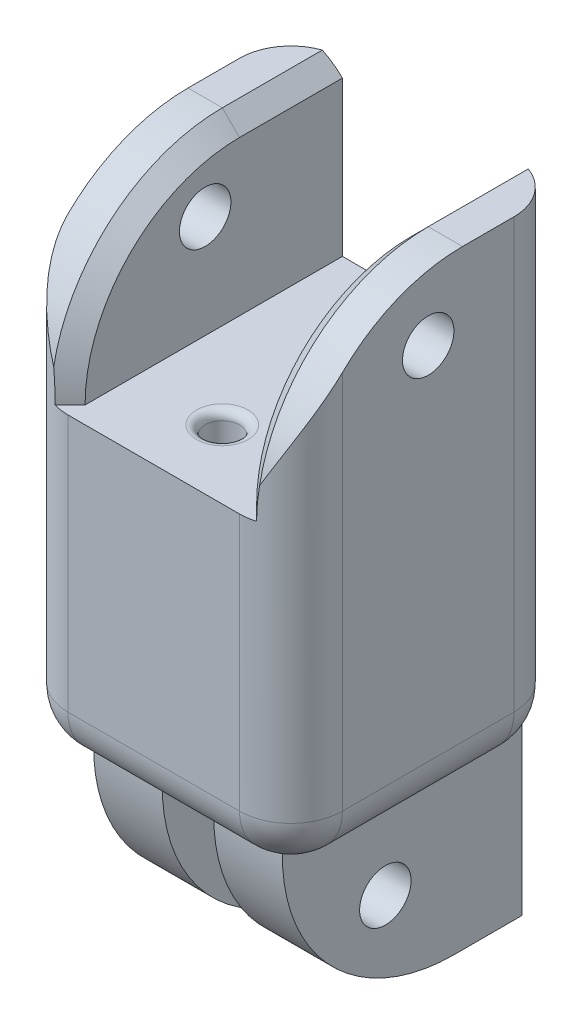
from build123d import *

# Parameters (mm, degrees)
BOSS_EXTRUDE1_DEPTH     = 16
CUT_EXTRUDE1_DEPTH      = 44.384905209
CUT_EXTRUDE1_DEPTH_BACK = 44.384905209
SKETCH2_R               = 1.5
FILLET1_DEPTH           = 38
SKETCH3_R               = 1
CUT_EXTRUDE2_DEPTH      = 35.960692377
FILLET2_R               = 3
CHAMFER1_SIZE           = 1
CONG_1_R                = 0.5


with BuildPart() as part:
    # Sketch1 → Boss-Extrude1 (new body)
    with BuildSketch(Plane.XY):
        Polygon((0, 0), (0, 10), (-2.5, 10), (-2.5, 38), (0.5, 38), (0.5, 28), (10.5, 28), (10.5, 38), (13.5, 38), (13.5, 10), (11, 10), (11, 0), (7, 0), (7, 10), (4, 10), (4, 0), align=None)
    extrude(amount=BOSS_EXTRUDE1_DEPTH)

    # Sketch2 → Cut-Extrude1 (cut, two sides: drawn at the far end of the back side and taken through both)
    with BuildSketch(Plane(origin=(11, 0, 0), x_dir=(0, 0, -1), z_dir=(1, 0, 0)).offset(-CUT_EXTRUDE1_DEPTH_BACK)):
        with BuildLine():
            Line((-16, 0), (-4, 0))
            ThreePointArc((-4, 0), (-11.071067812, 2.928932188), (-14, 10))
            Line((-14, 10), (-16, 10))
            Line((-16, 10), (-16, 0))
        make_face()
        with BuildLine():
            Line((-16, 38), (-16, 28))
            ThreePointArc((-16, 28), (-13.071067812, 35.071067812), (-6, 38))
            Line((-6, 38), (-16, 38))
        make_face()
        with Locations((-8, 5)):
            Circle(SKETCH2_R)
        with Locations(Location((-8, 34, 0), (0, 0, 90))):
            Circle(SKETCH2_R)
    extrude(amount=CUT_EXTRUDE1_DEPTH + CUT_EXTRUDE1_DEPTH_BACK, mode=Mode.SUBTRACT)

    # Fillet1: read off the stored shape, not the designer's step
    # Fillet1 outline → Fillet1 (cut)
    with BuildSketch(Plane(origin=(0, 0, 0), x_dir=(1, 0, 0), z_dir=(0, 1, 0))):
        with BuildLine():
            Line((13.5, 0), (10.5, 0))
            ThreePointArc((10.5, 0), (12.621320344, -0.878679656), (13.5, -3))
            Line((13.5, -3), (13.5, 0))
        make_face()
        with BuildLine():
            ThreePointArc((-2.5, -3), (-1.621320344, -0.878679656), (0.5, 0))
            Line((0.5, 0), (-2.5, 0))
            Line((-2.5, 0), (-2.5, -3))
        make_face()
        with BuildLine():
            Line((13.5, -16), (13.5, -13))
            ThreePointArc((13.5, -13), (12.621320344, -15.121320344), (10.5, -16))
            Line((10.5, -16), (13.5, -16))
        make_face()
        with BuildLine():
            ThreePointArc((0.5, -16), (-1.621320344, -15.121320344), (-2.5, -13))
            Line((-2.5, -13), (-2.5, -16))
            Line((-2.5, -16), (0.5, -16))
        make_face()
    extrude(amount=FILLET1_DEPTH, mode=Mode.SUBTRACT)

    # Sketch3 → Cut-Extrude2 (cut, through all)
    with BuildSketch(Plane.XZ.offset(-10)):
        with Locations(Location((5.5, 12, 0), (0, 0, 270))):
            Circle(SKETCH3_R)
        with Locations(Location((5.5, 4, 0), (0, 0, 270))):
            Circle(SKETCH3_R)
    extrude(amount=-CUT_EXTRUDE2_DEPTH, mode=Mode.SUBTRACT)

    # Fillet2
    # the kernel refuses this fillet: 3 mm, written as the material it takes off along each edge
    with BuildSketch(Plane(origin=(0.499999998, 10, 2.999999998), x_dir=(-1.0, 0, 5.011576341616869e-10), z_dir=(5.011576341616869e-10, 0, 1.0))) as fillet2_piece_1_section:
        with BuildLine():
            CenterArc((2.999999998 - FILLET2_R, -FILLET2_R), FILLET2_R, 0, 89.999999971)
            Line((2.999999998 - FILLET2_R, 0), (2.999999998, 0))
            Line((2.999999998, 0), (2.999999998, -FILLET2_R))
        make_face()
    fillet2_piece_1 = revolve(axis=Axis((0.499999998, 10, 2.999999998), (0, -1, 0)), revolution_arc=223.691304691, mode=Mode.PRIVATE)
    fillet2_piece_1 = split(fillet2_piece_1, bisect_by=Plane(origin=(0, 10, 2.999999998), z_dir=(-1, 0, 0)), keep=Keep.TOP, mode=Mode.PRIVATE)
    add(fillet2_piece_1, mode=Mode.SUBTRACT)
    with BuildSketch(Plane(origin=(10.500000002, 10, 2.999999998), x_dir=(-0.7230719874734535, 0, 0.6907726839787384), z_dir=(0.6907726839787384, 0, 0.7230719874734535))) as fillet2_piece_2_section:
        with BuildLine():
            CenterArc((2.999999998 - FILLET2_R, -FILLET2_R), FILLET2_R, 0, 89.999999971)
            Line((2.999999998, -FILLET2_R), (2.999999998, 0))
            Line((2.999999998, 0), (2.999999998 - FILLET2_R, 0))
        make_face()
    fillet2_piece_2 = revolve(axis=Axis((10.500000002, 10, 2.999999998), (0, -1, 0)), revolution_arc=223.691304691, mode=Mode.PRIVATE)
    fillet2_piece_2 = split(fillet2_piece_2, bisect_by=Plane(origin=(11, 10, 2.999999998), z_dir=(1, 0, 0)), keep=Keep.TOP, mode=Mode.PRIVATE)
    add(fillet2_piece_2, mode=Mode.SUBTRACT)
    with BuildSketch(Plane(origin=(10.5, 10, 16), x_dir=(0, 0, -1), z_dir=(-1, 0, 0))) as fillet2_piece_3_section:
        with BuildLine():
            CenterArc((FILLET2_R, -FILLET2_R), FILLET2_R, 90, 90)
            Line((0, -FILLET2_R), (0, 0))
            Line((0, 0), (FILLET2_R, 0))
        make_face()
    fillet2_piece_3 = extrude(amount=10, mode=Mode.PRIVATE)
    fillet2_piece_3 = fillet2_piece_3 - Plane(origin=(10.5, 10, 4), x_dir=(0, -1, 0), z_dir=(-1, 0, 0)) * Cylinder(10, 32, mode=Mode.PRIVATE)
    fillet2_piece_3 = split(fillet2_piece_3, bisect_by=Plane(origin=(7, 10, 16), z_dir=(1, 0, 0)), keep=Keep.TOP, mode=Mode.PRIVATE)
    add(fillet2_piece_3, mode=Mode.SUBTRACT)
    with BuildSketch(Plane(origin=(10.5, 10, 16), x_dir=(0, 0, -1), z_dir=(-1, 0, 0))) as fillet2_piece_4_section:
        with BuildLine():
            CenterArc((FILLET2_R, -FILLET2_R), FILLET2_R, 90, 90)
            Line((0, -FILLET2_R), (0, 0))
            Line((0, 0), (FILLET2_R, 0))
        make_face()
    fillet2_piece_4 = extrude(amount=10, mode=Mode.PRIVATE)
    fillet2_piece_4 = fillet2_piece_4 & Plane(origin=(10.5, 10, 4), x_dir=(0, -1, 0), z_dir=(-1, 0, 0)) * Cylinder(10, 32, mode=Mode.PRIVATE)
    fillet2_piece_4 = split(fillet2_piece_4, bisect_by=Plane(origin=(4, 10, 16), z_dir=(1, 0, 0)), keep=Keep.TOP, mode=Mode.PRIVATE)
    fillet2_piece_4 = split(fillet2_piece_4, bisect_by=Plane(origin=(7, 10, 16), z_dir=(-1, 0, 0)), keep=Keep.TOP, mode=Mode.PRIVATE)
    add(fillet2_piece_4, mode=Mode.SUBTRACT)
    with BuildSketch(Plane(origin=(10.5, 10, 16), x_dir=(0, 0, -1), z_dir=(-1, 0, 0))) as fillet2_piece_5_section:
        with BuildLine():
            CenterArc((FILLET2_R, -FILLET2_R), FILLET2_R, 90, 90)
            Line((0, -FILLET2_R), (0, 0))
            Line((0, 0), (FILLET2_R, 0))
        make_face()
    fillet2_piece_5 = extrude(amount=10, mode=Mode.PRIVATE)
    fillet2_piece_5 = fillet2_piece_5 - Plane(origin=(10.5, 10, 4), x_dir=(0, -1, 0), z_dir=(-1, 0, 0)) * Cylinder(10, 32, mode=Mode.PRIVATE)
    fillet2_piece_5 = split(fillet2_piece_5, bisect_by=Plane(origin=(4, 10, 16), z_dir=(1, 0, 0)), keep=Keep.TOP, mode=Mode.PRIVATE)
    fillet2_piece_5 = split(fillet2_piece_5, bisect_by=Plane(origin=(7, 10, 16), z_dir=(-1, 0, 0)), keep=Keep.TOP, mode=Mode.PRIVATE)
    add(fillet2_piece_5, mode=Mode.SUBTRACT)
    with BuildSketch(Plane(origin=(10.5, 10, 16), x_dir=(0, 0, -1), z_dir=(-1, 0, 0))) as fillet2_piece_6_section:
        with BuildLine():
            CenterArc((FILLET2_R, -FILLET2_R), FILLET2_R, 90, 90)
            Line((0, -FILLET2_R), (0, 0))
            Line((0, 0), (FILLET2_R, 0))
        make_face()
    fillet2_piece_6 = extrude(amount=10, mode=Mode.PRIVATE)
    fillet2_piece_6 = fillet2_piece_6 - Plane(origin=(10.5, 10, 4), x_dir=(0, -1, 0), z_dir=(-1, 0, 0)) * Cylinder(10, 32, mode=Mode.PRIVATE)
    fillet2_piece_6 = split(fillet2_piece_6, bisect_by=Plane(origin=(4, 10, 16), z_dir=(-1, 0, 0)), keep=Keep.TOP, mode=Mode.PRIVATE)
    add(fillet2_piece_6, mode=Mode.SUBTRACT)
    with BuildSketch(Plane(origin=(10.500000002, 10, 13.000000002), x_dir=(1.0, 0, -5.011588183995811e-10), z_dir=(-5.011588183995811e-10, 0, -1.0))) as fillet2_piece_7_section:
        with BuildLine():
            CenterArc((2.999999998 - FILLET2_R, -FILLET2_R), FILLET2_R, 0, 89.999999971)
            Line((2.999999998, -FILLET2_R), (2.999999998, 0))
            Line((2.999999998, 0), (2.999999998 - FILLET2_R, 0))
        make_face()
    fillet2_piece_7 = revolve(axis=Axis((10.500000002, 10, 13.000000002), (0, -1, 0)), revolution_arc=90.000000057, mode=Mode.PRIVATE)
    fillet2_piece_7 = fillet2_piece_7 & Plane(origin=(10.500000002, 10, 4), x_dir=(0, -1, 0), z_dir=(-1, 0, 0)) * Cylinder(10, 12, mode=Mode.PRIVATE)
    fillet2_piece_7 = split(fillet2_piece_7, bisect_by=Plane(origin=(11, 10, 13.000000002), z_dir=(1, 0, 0)), keep=Keep.TOP, mode=Mode.PRIVATE)
    add(fillet2_piece_7, mode=Mode.SUBTRACT)
    with BuildSketch(Plane(origin=(10.500000002, 10, 13.000000002), x_dir=(1.0, 0, -5.011588183995811e-10), z_dir=(-5.011588183995811e-10, 0, -1.0))) as fillet2_piece_8_section:
        with BuildLine():
            CenterArc((2.999999998 - FILLET2_R, -FILLET2_R), FILLET2_R, 0, 89.999999971)
            Line((2.999999998, -FILLET2_R), (2.999999998, 0))
            Line((2.999999998, 0), (2.999999998 - FILLET2_R, 0))
        make_face()
    fillet2_piece_8 = revolve(axis=Axis((10.500000002, 10, 13.000000002), (0, -1, 0)), revolution_arc=90.000000057, mode=Mode.PRIVATE)
    fillet2_piece_8 = fillet2_piece_8 - Plane(origin=(10.500000002, 10, 4), x_dir=(0, -1, 0), z_dir=(-1, 0, 0)) * Cylinder(10, 12, mode=Mode.PRIVATE)
    fillet2_piece_8 = split(fillet2_piece_8, bisect_by=Plane(origin=(11, 10, 13.000000002), z_dir=(-1, 0, 0)), keep=Keep.TOP, mode=Mode.PRIVATE)
    add(fillet2_piece_8, mode=Mode.SUBTRACT)
    with BuildSketch(Plane(origin=(10.500000002, 10, 13.000000002), x_dir=(1.0, 0, -5.011588183995811e-10), z_dir=(-5.011588183995811e-10, 0, -1.0))) as fillet2_piece_9_section:
        with BuildLine():
            CenterArc((2.999999998 - FILLET2_R, -FILLET2_R), FILLET2_R, 0, 89.999999971)
            Line((2.999999998, -FILLET2_R), (2.999999998, 0))
            Line((2.999999998, 0), (2.999999998 - FILLET2_R, 0))
        make_face()
    fillet2_piece_9 = revolve(axis=Axis((10.500000002, 10, 13.000000002), (0, -1, 0)), revolution_arc=90.000000057, mode=Mode.PRIVATE)
    fillet2_piece_9 = fillet2_piece_9 - Plane(origin=(10.500000002, 10, 4), x_dir=(0, -1, 0), z_dir=(-1, 0, 0)) * Cylinder(10, 12, mode=Mode.PRIVATE)
    fillet2_piece_9 = split(fillet2_piece_9, bisect_by=Plane(origin=(11, 10, 13.000000002), z_dir=(1, 0, 0)), keep=Keep.TOP, mode=Mode.PRIVATE)
    add(fillet2_piece_9, mode=Mode.SUBTRACT)
    with BuildSketch(Plane(origin=(0.499999998, 10, 13.000000002), x_dir=(5.011584483252393e-10, 0, 1.0), z_dir=(1.0, 0, -5.011584483252393e-10))) as fillet2_piece_10_section:
        with BuildLine():
            CenterArc((2.999999998 - FILLET2_R, -FILLET2_R), FILLET2_R, 0, 89.999999971)
            Line((2.999999998, -FILLET2_R), (2.999999998, 0))
            Line((2.999999998, 0), (2.999999998 - FILLET2_R, 0))
        make_face()
    fillet2_piece_10 = revolve(axis=Axis((0.499999998, 10, 13.000000002), (0, -1, 0)), revolution_arc=90.000000057, mode=Mode.PRIVATE)
    fillet2_piece_10 = split(fillet2_piece_10, bisect_by=Plane(origin=(0, 10, 13.000000002), z_dir=(1, 0, 0)), keep=Keep.TOP, mode=Mode.PRIVATE)
    fillet2_piece_10 = fillet2_piece_10 - Plane(origin=(0.499999998, 10, 4), x_dir=(0, -1, 0), z_dir=(-1, 0, 0)) * Cylinder(10, 12, mode=Mode.PRIVATE)
    add(fillet2_piece_10, mode=Mode.SUBTRACT)
    with BuildSketch(Plane(origin=(0.499999998, 10, 13.000000002), x_dir=(5.011584483252393e-10, 0, 1.0), z_dir=(1.0, 0, -5.011584483252393e-10))) as fillet2_piece_11_section:
        with BuildLine():
            CenterArc((2.999999998 - FILLET2_R, -FILLET2_R), FILLET2_R, 0, 89.999999971)
            Line((2.999999998, -FILLET2_R), (2.999999998, 0))
            Line((2.999999998, 0), (2.999999998 - FILLET2_R, 0))
        make_face()
    fillet2_piece_11 = revolve(axis=Axis((0.499999998, 10, 13.000000002), (0, -1, 0)), revolution_arc=90.000000057, mode=Mode.PRIVATE)
    fillet2_piece_11 = split(fillet2_piece_11, bisect_by=Plane(origin=(0, 10, 13.000000002), z_dir=(-1, 0, 0)), keep=Keep.TOP, mode=Mode.PRIVATE)
    fillet2_piece_11 = fillet2_piece_11 & Plane(origin=(0.499999998, 10, 4), x_dir=(0, -1, 0), z_dir=(-1, 0, 0)) * Cylinder(10, 12, mode=Mode.PRIVATE)
    add(fillet2_piece_11, mode=Mode.SUBTRACT)
    with BuildSketch(Plane(origin=(0.499999998, 10, 13.000000002), x_dir=(5.011584483252393e-10, 0, 1.0), z_dir=(1.0, 0, -5.011584483252393e-10))) as fillet2_piece_12_section:
        with BuildLine():
            CenterArc((2.999999998 - FILLET2_R, -FILLET2_R), FILLET2_R, 0, 89.999999971)
            Line((2.999999998, -FILLET2_R), (2.999999998, 0))
            Line((2.999999998, 0), (2.999999998 - FILLET2_R, 0))
        make_face()
    fillet2_piece_12 = revolve(axis=Axis((0.499999998, 10, 13.000000002), (0, -1, 0)), revolution_arc=90.000000057, mode=Mode.PRIVATE)
    fillet2_piece_12 = split(fillet2_piece_12, bisect_by=Plane(origin=(0, 10, 13.000000002), z_dir=(-1, 0, 0)), keep=Keep.TOP, mode=Mode.PRIVATE)
    fillet2_piece_12 = fillet2_piece_12 - Plane(origin=(0.499999998, 10, 4), x_dir=(0, -1, 0), z_dir=(-1, 0, 0)) * Cylinder(10, 12, mode=Mode.PRIVATE)
    add(fillet2_piece_12, mode=Mode.SUBTRACT)
    with BuildSketch(Plane(origin=(-2.5, 10, 13), x_dir=(1, 0, 0), z_dir=(0, 0, -1))) as fillet2_piece_13_section:
        with BuildLine():
            CenterArc((FILLET2_R, -FILLET2_R), FILLET2_R, 90, 90)
            Line((0, -FILLET2_R), (0, 0))
            Line((0, 0), (FILLET2_R, 0))
        make_face()
    fillet2_piece_13 = extrude(amount=10, mode=Mode.PRIVATE)
    fillet2_piece_13 = split(fillet2_piece_13, bisect_by=Plane(origin=(0, 10, 13), z_dir=(-1, 0, 0)), keep=Keep.TOP, mode=Mode.PRIVATE)
    add(fillet2_piece_13, mode=Mode.SUBTRACT)
    with BuildSketch(Plane(origin=(13.5, 10, 3), x_dir=(-1, 0, 0), z_dir=(0, 0, 1))) as fillet2_piece_14_section:
        with BuildLine():
            CenterArc((FILLET2_R, -FILLET2_R), FILLET2_R, 90, 90)
            Line((0, -FILLET2_R), (0, 0))
            Line((0, 0), (FILLET2_R, 0))
        make_face()
    fillet2_piece_14 = extrude(amount=10, mode=Mode.PRIVATE)
    fillet2_piece_14 = split(fillet2_piece_14, bisect_by=Plane(origin=(11, 10, 3), z_dir=(1, 0, 0)), keep=Keep.TOP, mode=Mode.PRIVATE)
    add(fillet2_piece_14, mode=Mode.SUBTRACT)

    # Chamfer1
    # the kernel refuses this chamfer: 1 mm, written as the material it takes off along each edge
    with BuildSketch(Plane(origin=(10.5, 38, -2.571682988), x_dir=(0, -1, 0), z_dir=(0, 0, 1)), Plane(origin=(0.5, 38, -2.571682988), x_dir=(-1, 0, 0), z_dir=(0, 0, 1))) as chamfer1_piece_1:
        Polygon((CHAMFER1_SIZE, 0), (0, CHAMFER1_SIZE), (0, 0), align=None)
    extrude(amount=8.571682988, mode=Mode.SUBTRACT)
    with BuildSketch(Plane(origin=(10.5, 28, 6), x_dir=(0, 0, 1), z_dir=(0, -1, 0))) as chamfer1_piece_2:
        Polygon((10 - CHAMFER1_SIZE, 0), (10, -CHAMFER1_SIZE), (10, 0), align=None)
    revolve(axis=Axis((10.5, 28, 6), (-1, 0, 0)), revolution_arc=90, mode=Mode.SUBTRACT)
    with BuildSketch(Plane(origin=(0.5, 28, 6), x_dir=(0, 0, 1), z_dir=(0, -1, 0))) as chamfer1_piece_3:
        Polygon((10 - CHAMFER1_SIZE, 0), (10, CHAMFER1_SIZE), (10, 0), align=None)
    revolve(axis=Axis((0.5, 28, 6), (-1, 0, 0)), revolution_arc=90, mode=Mode.SUBTRACT)

    # Congé1
    cong_1_edges = [part.edges().sort_by_distance(p)[0] for p in [
        (5.5, 28, 13),
        (4.5, 10, 12),
        (5.5, 28, 5),
        (5.5, 10, 5),
    ]]
    fillet(cong_1_edges, radius=CONG_1_R - 0.0001)  # a hair under: the kernel refuses the full size


solid = part.part
